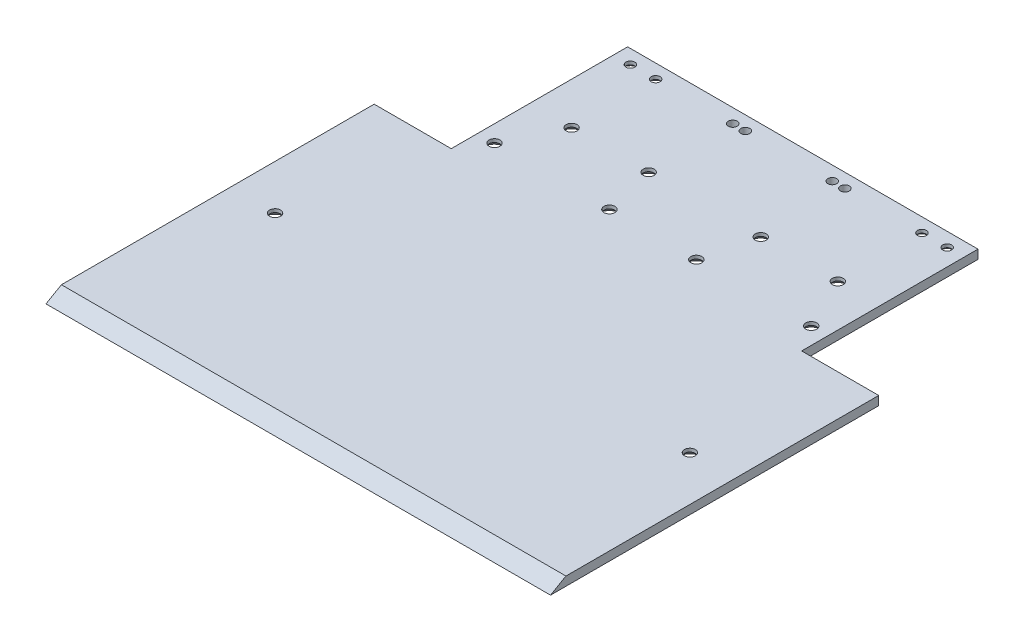
from build123d import *

# Parameters (mm, degrees)
SALIENTE_EXTRUIR1_DEPTH                      = 3.17
CORTAR_EXTRUIR1_REACH                        = 203.271
CORTAR_EXTRUIR2_REACH                        = 129.319
CROQUIS3_R                                   = 1.585
CORTAR_EXTRUIR3_REACH                        = 129.319
CROQUIS4_R                                   = 1.585
CORTAR_EXTRUIR4_REACH                        = 129.319
CROQUIS6_R                                   = 1.585
CORTAR_EXTRUIR5_REACH                        = 129.319
CROQUIS7_R                                   = 1.585
CROQUIS15_R                                  = 4
CORTAR_EXTRUIR6_DEPTH                        = 2
CORTAR_EXTRUIR6_DRAFT                        = -50.5
CORTAR_EXTRUIR6_PROFILE_2_DEPTH              = 2
CORTAR_EXTRUIR6_PROFILE_2_DRAFT              = -50.5
CORTAR_EXTRUIR6_PROFILE_3_DEPTH              = 2
CORTAR_EXTRUIR6_PROFILE_3_DRAFT              = -50.5
CORTAR_EXTRUIR6_PROFILE_4_DEPTH              = 2
CORTAR_EXTRUIR6_PROFILE_4_DRAFT              = -50.5
CORTAR_EXTRUIR6_PROFILE_5_DEPTH              = 2
CORTAR_EXTRUIR6_PROFILE_5_DRAFT              = -50.5
CORTAR_EXTRUIR6_PROFILE_6_DEPTH              = 2
CORTAR_EXTRUIR6_PROFILE_6_DRAFT              = -50.5
CORTAR_EXTRUIR6_PROFILE_7_DEPTH              = 2
CORTAR_EXTRUIR6_PROFILE_7_DRAFT              = -50.5
SIMETR_A3_COPY_1_SKETCH_R                    = 4
SIMETR_A3_COPY_1_DEPTH                       = 2
SIMETR_A3_COPY_1_DRAFT                       = -50.5
SIMETR_A3_COPY_2_SKETCH_R                    = 4
SIMETR_A3_COPY_2_DEPTH                       = 2
SIMETR_A3_COPY_2_DRAFT                       = -50.5
SIMETR_A3_COPY_3_SKETCH_R                    = 4
SIMETR_A3_COPY_3_DEPTH                       = 2
SIMETR_A3_COPY_3_DRAFT                       = -50.5
SIMETR_A3_COPY_4_SKETCH_R                    = 4
SIMETR_A3_COPY_4_DEPTH                       = 2
SIMETR_A3_COPY_4_DRAFT                       = -50.5
SIMETR_A3_COPY_5_SKETCH_R                    = 4
SIMETR_A3_COPY_5_DEPTH                       = 2
SIMETR_A3_COPY_5_DRAFT                       = -50.5
SIMETR_A3_COPY_6_SKETCH_R                    = 4
SIMETR_A3_COPY_6_DEPTH                       = 2
SIMETR_A3_COPY_6_DRAFT                       = -50.5
SIMETR_A3_COPY_7_SKETCH_R                    = 4
SIMETR_A3_COPY_7_DEPTH                       = 2
SIMETR_A3_COPY_7_DRAFT                       = -50.5
SIMETR_A3_COPY_8_SKETCH_R                    = 4
SIMETR_A3_COPY_8_DEPTH                       = 2
SIMETR_A3_COPY_8_DRAFT                       = -50.5
SIMETR_A3_COPY_9_SKETCH_R                    = 4
SIMETR_A3_COPY_9_DEPTH                       = 2
SIMETR_A3_COPY_9_DRAFT                       = -50.5
SIMETR_A3_COPY_10_SKETCH_R                   = 4
SIMETR_A3_COPY_10_DEPTH                      = 2
SIMETR_A3_COPY_10_DRAFT                      = -50.5
SIMETR_A3_COPY_11_SKETCH_R                   = 4
SIMETR_A3_COPY_11_DEPTH                      = 2
SIMETR_A3_COPY_11_DRAFT                      = -50.5
SIMETR_A3_COPY_12_SKETCH_R                   = 4
SIMETR_A3_COPY_12_DEPTH                      = 2
SIMETR_A3_COPY_12_DRAFT                      = -50.5
SIMETR_A3_COPY_13_SKETCH_R                   = 4
SIMETR_A3_COPY_13_DEPTH                      = 2
SIMETR_A3_COPY_13_DRAFT                      = -50.5
AVELLANADO_PARA_TORNILLO_CON_CABEZA_2_COUNT  = 2
AVELLANADO_PARA_TORNILLO_CON_CABEZA_2_PITCH  = 63.24912037
AVELLANADO_PARA_TORNILLO_CON_CABEZA_3_COUNT  = 2
AVELLANADO_PARA_TORNILLO_CON_CABEZA_3_PITCH  = 83.591620659
AVELLANADO_PARA_TORNILLO_CON_CABEZA_4_COUNT  = 2
AVELLANADO_PARA_TORNILLO_CON_CABEZA_4_PITCH  = 95.923454089
AVELLANADO_PARA_TORNILLO_CON_CABEZA_5_COUNT  = 2
AVELLANADO_PARA_TORNILLO_CON_CABEZA_5_PITCH  = 84.359061325
AVELLANADO_PARA_TORNILLO_CON_CABEZA_6_COUNT  = 2
AVELLANADO_PARA_TORNILLO_CON_CABEZA_6_PITCH  = 108.187112114
AVELLANADO_PARA_TORNILLO_CON_CABEZA_7_COUNT  = 2
AVELLANADO_PARA_TORNILLO_CON_CABEZA_7_PITCH  = 122.968731979
AVELLANADO_PARA_TORNILLO_CON_CABEZA_8_COUNT  = 2
AVELLANADO_PARA_TORNILLO_CON_CABEZA_8_PITCH  = 145.077768953
AVELLANADO_PARA_TORNILLO_CON_CABEZA_9_COUNT  = 2
AVELLANADO_PARA_TORNILLO_CON_CABEZA_9_PITCH  = 143.959894511
AVELLANADO_PARA_TORNILLO_CON_CABEZA_10_COUNT = 2
AVELLANADO_PARA_TORNILLO_CON_CABEZA_10_PITCH = 148


with BuildPart() as part:
    # Croquis1 → Saliente-Extruir1 (new body)
    with BuildSketch(Plane(origin=(0, 0, 0), x_dir=(1, 0, 0), z_dir=(0, 1, 0))):
        Polygon((-62.5, 90), (-62.5, 27.08), (-90, 27.08), (-90, -90), (90, -90), (90, 27.08), (62.5, 27.08), (62.5, 90), align=None)
    extrude(amount=SALIENTE_EXTRUIR1_DEPTH)

    # Croquis2 → Cortar-Extruir1 (cut, up to next)
    with BuildSketch(Plane.ZY.offset(90), mode=Mode.PRIVATE) as cortar_extruir1_sk1:
        Polygon((90, 0), (84.50939894, 3.17), (90, 3.17), align=None)
    cortar_extruir1_tool1 = extrude(cortar_extruir1_sk1.sketch, amount=-CORTAR_EXTRUIR1_REACH, mode=Mode.PRIVATE) & part.part
    add(cortar_extruir1_tool1.solids().sort_by_distance((-90, 2.113333, 88.1698))[0], mode=Mode.SUBTRACT)

    # Croquis3 → Cortar-Extruir2 (cut, up to next)
    with BuildSketch(Plane(origin=(0, 3.17, 0), x_dir=(1, 0, 0), z_dir=(0, 1, 0)), mode=Mode.PRIVATE) as cortar_extruir2_sk1:
        with Locations((74, -24.279339937)):
            Circle(CROQUIS3_R)
    cortar_extruir2_tool1 = extrude(cortar_extruir2_sk1.sketch, amount=-CORTAR_EXTRUIR2_REACH, mode=Mode.PRIVATE) & part.part
    cortar_extruir2 = cortar_extruir2_tool1.solids().sort_by_distance((74, 3.17, 24.27934))[0]
    add(cortar_extruir2, mode=Mode.SUBTRACT)

    # Simetría1: Cortar-Extruir2 across plane
    add(cortar_extruir2.mirror(Plane(origin=(0, 0, 0), x_dir=(0, 0, 1), z_dir=(1, 0, 0))), mode=Mode.SUBTRACT)

    # Croquis4 → Cortar-Extruir3 (cut, up to next)
    with BuildSketch(Plane(origin=(0, 3.17, 0), x_dir=(1, 0, 0), z_dir=(0, 1, 0)), mode=Mode.PRIVATE) as cortar_extruir3_sk1:
        with Locations((-56.5, 36.50060106)):
            Circle(CROQUIS4_R)
    cortar_extruir3_tool1 = extrude(cortar_extruir3_sk1.sketch, amount=-CORTAR_EXTRUIR3_REACH, mode=Mode.PRIVATE) & part.part
    # Croquis4 → Cortar-Extruir3 (cut, up to next)
    with BuildSketch(Plane(origin=(0, 3.17, 0), x_dir=(1, 0, 0), z_dir=(0, 1, 0)), mode=Mode.PRIVATE) as cortar_extruir3_sk2:
        with Locations((-15.5, 36.50060106)):
            Circle(CROQUIS4_R)
    cortar_extruir3_tool2 = extrude(cortar_extruir3_sk2.sketch, amount=-CORTAR_EXTRUIR3_REACH, mode=Mode.PRIVATE) & part.part
    # Croquis4 → Cortar-Extruir3 (cut, up to next)
    with BuildSketch(Plane(origin=(0, 3.17, 0), x_dir=(1, 0, 0), z_dir=(0, 1, 0)), mode=Mode.PRIVATE) as cortar_extruir3_sk3:
        with Locations((-15.5, 85.00060106)):
            Circle(CROQUIS4_R)
    cortar_extruir3_tool3 = extrude(cortar_extruir3_sk3.sketch, amount=-CORTAR_EXTRUIR3_REACH, mode=Mode.PRIVATE) & part.part
    # Croquis4 → Cortar-Extruir3 (cut, up to next)
    with BuildSketch(Plane(origin=(0, 3.17, 0), x_dir=(1, 0, 0), z_dir=(0, 1, 0)), mode=Mode.PRIVATE) as cortar_extruir3_sk4:
        with Locations((-56.5, 85.00060106)):
            Circle(CROQUIS4_R)
    cortar_extruir3_tool4 = extrude(cortar_extruir3_sk4.sketch, amount=-CORTAR_EXTRUIR3_REACH, mode=Mode.PRIVATE) & part.part
    add(cortar_extruir3_tool1.solids().sort_by_distance((-56.5, 3.17, -36.500601))[0], mode=Mode.SUBTRACT)
    add(cortar_extruir3_tool2.solids().sort_by_distance((-15.5, 3.17, -36.500601))[0], mode=Mode.SUBTRACT)
    add(cortar_extruir3_tool3.solids().sort_by_distance((-15.5, 3.17, -85.000601))[0], mode=Mode.SUBTRACT)
    add(cortar_extruir3_tool4.solids().sort_by_distance((-56.5, 3.17, -85.000601))[0], mode=Mode.SUBTRACT)

    # Croquis6 → Cortar-Extruir4 (cut, up to next)
    with BuildSketch(Plane(origin=(0, 3.17, 0), x_dir=(1, 0, 0), z_dir=(0, 1, 0)), mode=Mode.PRIVATE) as cortar_extruir4_sk1:
        with Locations((56.5, 85.00060106)):
            Circle(CROQUIS6_R)
    cortar_extruir4_tool1 = extrude(cortar_extruir4_sk1.sketch, amount=-CORTAR_EXTRUIR4_REACH, mode=Mode.PRIVATE) & part.part
    # Croquis6 → Cortar-Extruir4 (cut, up to next)
    with BuildSketch(Plane(origin=(0, 3.17, 0), x_dir=(1, 0, 0), z_dir=(0, 1, 0)), mode=Mode.PRIVATE) as cortar_extruir4_sk2:
        with Locations((15.5, 85.00060106)):
            Circle(CROQUIS6_R)
    cortar_extruir4_tool2 = extrude(cortar_extruir4_sk2.sketch, amount=-CORTAR_EXTRUIR4_REACH, mode=Mode.PRIVATE) & part.part
    # Croquis6 → Cortar-Extruir4 (cut, up to next)
    with BuildSketch(Plane(origin=(0, 3.17, 0), x_dir=(1, 0, 0), z_dir=(0, 1, 0)), mode=Mode.PRIVATE) as cortar_extruir4_sk3:
        with Locations((15.5, 36.50060106)):
            Circle(CROQUIS6_R)
    cortar_extruir4_tool3 = extrude(cortar_extruir4_sk3.sketch, amount=-CORTAR_EXTRUIR4_REACH, mode=Mode.PRIVATE) & part.part
    # Croquis6 → Cortar-Extruir4 (cut, up to next)
    with BuildSketch(Plane(origin=(0, 3.17, 0), x_dir=(1, 0, 0), z_dir=(0, 1, 0)), mode=Mode.PRIVATE) as cortar_extruir4_sk4:
        with Locations((56.5, 36.50060106)):
            Circle(CROQUIS6_R)
    cortar_extruir4_tool4 = extrude(cortar_extruir4_sk4.sketch, amount=-CORTAR_EXTRUIR4_REACH, mode=Mode.PRIVATE) & part.part
    add(cortar_extruir4_tool1.solids().sort_by_distance((56.5, 3.17, -85.000601))[0], mode=Mode.SUBTRACT)
    add(cortar_extruir4_tool2.solids().sort_by_distance((15.5, 3.17, -85.000601))[0], mode=Mode.SUBTRACT)
    add(cortar_extruir4_tool3.solids().sort_by_distance((15.5, 3.17, -36.500601))[0], mode=Mode.SUBTRACT)
    add(cortar_extruir4_tool4.solids().sort_by_distance((56.5, 3.17, -36.500601))[0], mode=Mode.SUBTRACT)

    # Croquis7 → Cortar-Extruir5 (cut, up to next)
    with BuildSketch(Plane(origin=(0, 3.17, 0), x_dir=(1, 0, 0), z_dir=(0, 1, 0)), mode=Mode.PRIVATE) as cortar_extruir5_sk1:
        with Locations((-20, 85.00060106)):
            Circle(CROQUIS7_R)
    cortar_extruir5_tool1 = extrude(cortar_extruir5_sk1.sketch, amount=-CORTAR_EXTRUIR5_REACH, mode=Mode.PRIVATE) & part.part
    # Croquis7 → Cortar-Extruir5 (cut, up to next)
    with BuildSketch(Plane(origin=(0, 3.17, 0), x_dir=(1, 0, 0), z_dir=(0, 1, 0)), mode=Mode.PRIVATE) as cortar_extruir5_sk2:
        with Locations((-47.5, 85.00060106)):
            Circle(CROQUIS7_R)
    cortar_extruir5_tool2 = extrude(cortar_extruir5_sk2.sketch, amount=-CORTAR_EXTRUIR5_REACH, mode=Mode.PRIVATE) & part.part
    # Croquis7 → Cortar-Extruir5 (cut, up to next)
    with BuildSketch(Plane(origin=(0, 3.17, 0), x_dir=(1, 0, 0), z_dir=(0, 1, 0)), mode=Mode.PRIVATE) as cortar_extruir5_sk3:
        with Locations((-47.5, 55.00060106)):
            Circle(CROQUIS7_R)
    cortar_extruir5_tool3 = extrude(cortar_extruir5_sk3.sketch, amount=-CORTAR_EXTRUIR5_REACH, mode=Mode.PRIVATE) & part.part
    # Croquis7 → Cortar-Extruir5 (cut, up to next)
    with BuildSketch(Plane(origin=(0, 3.17, 0), x_dir=(1, 0, 0), z_dir=(0, 1, 0)), mode=Mode.PRIVATE) as cortar_extruir5_sk4:
        with Locations((-20, 55.00060106)):
            Circle(CROQUIS7_R)
    cortar_extruir5_tool4 = extrude(cortar_extruir5_sk4.sketch, amount=-CORTAR_EXTRUIR5_REACH, mode=Mode.PRIVATE) & part.part
    cortar_extruir5_1 = cortar_extruir5_tool1.solids().sort_by_distance((-20, 3.17, -85.000601))[0]
    add(cortar_extruir5_1, mode=Mode.SUBTRACT)
    cortar_extruir5_2 = cortar_extruir5_tool2.solids().sort_by_distance((-47.5, 3.17, -85.000601))[0]
    add(cortar_extruir5_2, mode=Mode.SUBTRACT)
    cortar_extruir5_3 = cortar_extruir5_tool3.solids().sort_by_distance((-47.5, 3.17, -55.000601))[0]
    add(cortar_extruir5_3, mode=Mode.SUBTRACT)
    cortar_extruir5_4 = cortar_extruir5_tool4.solids().sort_by_distance((-20, 3.17, -55.000601))[0]
    add(cortar_extruir5_4, mode=Mode.SUBTRACT)
    cortar_extruir5 = cortar_extruir5_1 + cortar_extruir5_2 + cortar_extruir5_3 + cortar_extruir5_4  # Cortar-Extruir5 as one shape, for the pattern or mirror that repeats it

    # Simetría2: Cortar-Extruir5 across plane
    add(cortar_extruir5.mirror(Plane(origin=(0, 0, 0), x_dir=(0, 0, 1), z_dir=(1, 0, 0))), mode=Mode.SUBTRACT)


with BuildPart() as cortar_extruir6_tool:
    # Croquis15 → Cortar-Extruir6 (with draft: the straight prism first)
    with BuildSketch(Plane(origin=(0, 0, 0), x_dir=(-1, 0, 0), z_dir=(0, -1, 0))):
        with Locations((20, 55.00060106)):
            Circle(CROQUIS15_R)
    extrude(amount=-CORTAR_EXTRUIR6_DEPTH)
    # Cortar-Extruir6: the draft: its side faces are tilted about the plane it starts from
    cortar_extruir6_sides = [cortar_extruir6_tool.faces().sort_by_distance(p)[0] for p in [
        (-16, 1, -55.00060106),
    ]]
    draft(cortar_extruir6_sides, Plane(origin=(0, 0, 0), x_dir=(-1, 0, 0), z_dir=(0, -1, 0)), CORTAR_EXTRUIR6_DRAFT)


with BuildPart() as part_1:
    add(part.part)

    # Cortar-Extruir6: cut by cortar_extruir6_tool
    add(cortar_extruir6_tool.part, mode=Mode.SUBTRACT)


with BuildPart() as cortar_extruir6_profile_2_tool:
    # Croquis15 → Cortar-Extruir6 profile 2 (with draft: the straight prism first)
    with BuildSketch(Plane(origin=(0, 0, 0), x_dir=(-1, 0, 0), z_dir=(0, -1, 0))):
        with Locations((15.5, 36.50060106)):
            Circle(CROQUIS15_R)
    extrude(amount=-CORTAR_EXTRUIR6_PROFILE_2_DEPTH)
    # Cortar-Extruir6 profile 2: the draft: its side faces are tilted about the plane it starts from
    cortar_extruir6_profile_2_sides = [cortar_extruir6_profile_2_tool.faces().sort_by_distance(p)[0] for p in [
        (-11.5, 1, -36.50060106),
    ]]
    draft(cortar_extruir6_profile_2_sides, Plane(origin=(0, 0, 0), x_dir=(-1, 0, 0), z_dir=(0, -1, 0)), CORTAR_EXTRUIR6_PROFILE_2_DRAFT)


with BuildPart() as part_2:
    add(part_1.part)

    # Cortar-Extruir6 profile 2: cut by cortar_extruir6_profile_2_tool
    add(cortar_extruir6_profile_2_tool.part, mode=Mode.SUBTRACT)


with BuildPart() as cortar_extruir6_profile_3_tool:
    # Croquis15 → Cortar-Extruir6 profile 3 (with draft: the straight prism first)
    with BuildSketch(Plane(origin=(0, 0, 0), x_dir=(-1, 0, 0), z_dir=(0, -1, 0))):
        with Locations((56.5, 36.50060106)):
            Circle(CROQUIS15_R)
    extrude(amount=-CORTAR_EXTRUIR6_PROFILE_3_DEPTH)
    # Cortar-Extruir6 profile 3: the draft: its side faces are tilted about the plane it starts from
    cortar_extruir6_profile_3_sides = [cortar_extruir6_profile_3_tool.faces().sort_by_distance(p)[0] for p in [
        (-52.5, 1, -36.50060106),
    ]]
    draft(cortar_extruir6_profile_3_sides, Plane(origin=(0, 0, 0), x_dir=(-1, 0, 0), z_dir=(0, -1, 0)), CORTAR_EXTRUIR6_PROFILE_3_DRAFT)


with BuildPart() as part_3:
    add(part_2.part)

    # Cortar-Extruir6 profile 3: cut by cortar_extruir6_profile_3_tool
    add(cortar_extruir6_profile_3_tool.part, mode=Mode.SUBTRACT)


with BuildPart() as cortar_extruir6_profile_4_tool:
    # Croquis15 → Cortar-Extruir6 profile 4 (with draft: the straight prism first)
    with BuildSketch(Plane(origin=(0, 0, 0), x_dir=(-1, 0, 0), z_dir=(0, -1, 0))):
        with Locations((47.5, 55.00060106)):
            Circle(CROQUIS15_R)
    extrude(amount=-CORTAR_EXTRUIR6_PROFILE_4_DEPTH)
    # Cortar-Extruir6 profile 4: the draft: its side faces are tilted about the plane it starts from
    cortar_extruir6_profile_4_sides = [cortar_extruir6_profile_4_tool.faces().sort_by_distance(p)[0] for p in [
        (-43.5, 1, -55.00060106),
    ]]
    draft(cortar_extruir6_profile_4_sides, Plane(origin=(0, 0, 0), x_dir=(-1, 0, 0), z_dir=(0, -1, 0)), CORTAR_EXTRUIR6_PROFILE_4_DRAFT)


with BuildPart() as part_4:
    add(part_3.part)

    # Cortar-Extruir6 profile 4: cut by cortar_extruir6_profile_4_tool
    add(cortar_extruir6_profile_4_tool.part, mode=Mode.SUBTRACT)


with BuildPart() as cortar_extruir6_profile_5_tool:
    # Croquis15 → Cortar-Extruir6 profile 5 (with draft: the straight prism first)
    with BuildSketch(Plane(origin=(0, 0, 0), x_dir=(-1, 0, 0), z_dir=(0, -1, 0))):
        with Locations((56.5, 85.00060106)):
            Circle(CROQUIS15_R)
    extrude(amount=-CORTAR_EXTRUIR6_PROFILE_5_DEPTH)
    # Cortar-Extruir6 profile 5: the draft: its side faces are tilted about the plane it starts from
    cortar_extruir6_profile_5_sides = [cortar_extruir6_profile_5_tool.faces().sort_by_distance(p)[0] for p in [
        (-52.5, 1, -85.00060106),
    ]]
    draft(cortar_extruir6_profile_5_sides, Plane(origin=(0, 0, 0), x_dir=(-1, 0, 0), z_dir=(0, -1, 0)), CORTAR_EXTRUIR6_PROFILE_5_DRAFT)


with BuildPart() as part_5:
    add(part_4.part)

    # Cortar-Extruir6 profile 5: cut by cortar_extruir6_profile_5_tool
    add(cortar_extruir6_profile_5_tool.part, mode=Mode.SUBTRACT)


with BuildPart() as cortar_extruir6_profile_6_tool:
    # Croquis15 → Cortar-Extruir6 profile 6 (with draft: the straight prism first)
    with BuildSketch(Plane(origin=(0, 0, 0), x_dir=(-1, 0, 0), z_dir=(0, -1, 0))):
        with Locations((47.5, 85.00060106)):
            Circle(CROQUIS15_R)
    extrude(amount=-CORTAR_EXTRUIR6_PROFILE_6_DEPTH)
    # Cortar-Extruir6 profile 6: the draft: its side faces are tilted about the plane it starts from
    cortar_extruir6_profile_6_sides = [cortar_extruir6_profile_6_tool.faces().sort_by_distance(p)[0] for p in [
        (-43.5, 1, -85.00060106),
    ]]
    draft(cortar_extruir6_profile_6_sides, Plane(origin=(0, 0, 0), x_dir=(-1, 0, 0), z_dir=(0, -1, 0)), CORTAR_EXTRUIR6_PROFILE_6_DRAFT)


with BuildPart() as part_6:
    add(part_5.part)

    # Cortar-Extruir6 profile 6: cut by cortar_extruir6_profile_6_tool
    add(cortar_extruir6_profile_6_tool.part, mode=Mode.SUBTRACT)


with BuildPart() as cortar_extruir6_profile_7_tool:
    # Croquis15 → Cortar-Extruir6 profile 7 (with draft: the straight prism first)
    with BuildSketch(Plane(origin=(0, 0, 0), x_dir=(-1, 0, 0), z_dir=(0, -1, 0))):
        with Locations((74, -24.279339937)):
            Circle(CROQUIS15_R)
    extrude(amount=-CORTAR_EXTRUIR6_PROFILE_7_DEPTH)
    # Cortar-Extruir6 profile 7: the draft: its side faces are tilted about the plane it starts from
    cortar_extruir6_profile_7_sides = [cortar_extruir6_profile_7_tool.faces().sort_by_distance(p)[0] for p in [
        (-70, 1, 24.279339937),
    ]]
    draft(cortar_extruir6_profile_7_sides, Plane(origin=(0, 0, 0), x_dir=(-1, 0, 0), z_dir=(0, -1, 0)), CORTAR_EXTRUIR6_PROFILE_7_DRAFT)


with BuildPart() as part_7:
    add(part_6.part)

    # Cortar-Extruir6 profile 7: cut by cortar_extruir6_profile_7_tool
    add(cortar_extruir6_profile_7_tool.part, mode=Mode.SUBTRACT)


with BuildPart() as simetr_a3_copy_1_tool:
    # Simetría3 copy 1 sketch → Simetría3 copy 1 (with draft: the straight prism first)
    with BuildSketch(Plane.XZ):
        with Locations((20, -55.00060106)):
            Circle(SIMETR_A3_COPY_1_SKETCH_R)
    extrude(amount=-SIMETR_A3_COPY_1_DEPTH)
    # Simetría3 copy 1: the draft: its side faces are tilted about the plane it starts from
    simetr_a3_copy_1_sides = [simetr_a3_copy_1_tool.faces().sort_by_distance(p)[0] for p in [
        (16, 1, -55.00060106),
    ]]
    draft(simetr_a3_copy_1_sides, Plane.XZ, SIMETR_A3_COPY_1_DRAFT)


with BuildPart() as part_8:
    add(part_7.part)

    # Simetría3 copy 1: cut by simetr_a3_copy_1_tool
    add(simetr_a3_copy_1_tool.part, mode=Mode.SUBTRACT)


with BuildPart() as simetr_a3_copy_2_tool:
    # Simetría3 copy 2 sketch → Simetría3 copy 2 (with draft: the straight prism first)
    with BuildSketch(Plane.XZ):
        with Locations((15.5, -36.50060106)):
            Circle(SIMETR_A3_COPY_2_SKETCH_R)
    extrude(amount=-SIMETR_A3_COPY_2_DEPTH)
    # Simetría3 copy 2: the draft: its side faces are tilted about the plane it starts from
    simetr_a3_copy_2_sides = [simetr_a3_copy_2_tool.faces().sort_by_distance(p)[0] for p in [
        (11.5, 1, -36.50060106),
    ]]
    draft(simetr_a3_copy_2_sides, Plane.XZ, SIMETR_A3_COPY_2_DRAFT)


with BuildPart() as part_9:
    add(part_8.part)

    # Simetría3 copy 2: cut by simetr_a3_copy_2_tool
    add(simetr_a3_copy_2_tool.part, mode=Mode.SUBTRACT)


with BuildPart() as simetr_a3_copy_3_tool:
    # Simetría3 copy 3 sketch → Simetría3 copy 3 (with draft: the straight prism first)
    with BuildSketch(Plane.XZ):
        with Locations((56.5, -36.50060106)):
            Circle(SIMETR_A3_COPY_3_SKETCH_R)
    extrude(amount=-SIMETR_A3_COPY_3_DEPTH)
    # Simetría3 copy 3: the draft: its side faces are tilted about the plane it starts from
    simetr_a3_copy_3_sides = [simetr_a3_copy_3_tool.faces().sort_by_distance(p)[0] for p in [
        (52.5, 1, -36.50060106),
    ]]
    draft(simetr_a3_copy_3_sides, Plane.XZ, SIMETR_A3_COPY_3_DRAFT)


with BuildPart() as part_10:
    add(part_9.part)

    # Simetría3 copy 3: cut by simetr_a3_copy_3_tool
    add(simetr_a3_copy_3_tool.part, mode=Mode.SUBTRACT)


with BuildPart() as simetr_a3_copy_4_tool:
    # Simetría3 copy 4 sketch → Simetría3 copy 4 (with draft: the straight prism first)
    with BuildSketch(Plane.XZ):
        with Locations((47.5, -55.00060106)):
            Circle(SIMETR_A3_COPY_4_SKETCH_R)
    extrude(amount=-SIMETR_A3_COPY_4_DEPTH)
    # Simetría3 copy 4: the draft: its side faces are tilted about the plane it starts from
    simetr_a3_copy_4_sides = [simetr_a3_copy_4_tool.faces().sort_by_distance(p)[0] for p in [
        (43.5, 1, -55.00060106),
    ]]
    draft(simetr_a3_copy_4_sides, Plane.XZ, SIMETR_A3_COPY_4_DRAFT)


with BuildPart() as part_11:
    add(part_10.part)

    # Simetría3 copy 4: cut by simetr_a3_copy_4_tool
    add(simetr_a3_copy_4_tool.part, mode=Mode.SUBTRACT)


with BuildPart() as simetr_a3_copy_5_tool:
    # Simetría3 copy 5 sketch → Simetría3 copy 5 (with draft: the straight prism first)
    with BuildSketch(Plane.XZ):
        with Locations((56.5, -85.00060106)):
            Circle(SIMETR_A3_COPY_5_SKETCH_R)
    extrude(amount=-SIMETR_A3_COPY_5_DEPTH)
    # Simetría3 copy 5: the draft: its side faces are tilted about the plane it starts from
    simetr_a3_copy_5_sides = [simetr_a3_copy_5_tool.faces().sort_by_distance(p)[0] for p in [
        (52.5, 1, -85.00060106),
    ]]
    draft(simetr_a3_copy_5_sides, Plane.XZ, SIMETR_A3_COPY_5_DRAFT)


with BuildPart() as part_12:
    add(part_11.part)

    # Simetría3 copy 5: cut by simetr_a3_copy_5_tool
    add(simetr_a3_copy_5_tool.part, mode=Mode.SUBTRACT)


with BuildPart() as simetr_a3_copy_6_tool:
    # Simetría3 copy 6 sketch → Simetría3 copy 6 (with draft: the straight prism first)
    with BuildSketch(Plane.XZ):
        with Locations((47.5, -85.00060106)):
            Circle(SIMETR_A3_COPY_6_SKETCH_R)
    extrude(amount=-SIMETR_A3_COPY_6_DEPTH)
    # Simetría3 copy 6: the draft: its side faces are tilted about the plane it starts from
    simetr_a3_copy_6_sides = [simetr_a3_copy_6_tool.faces().sort_by_distance(p)[0] for p in [
        (43.5, 1, -85.00060106),
    ]]
    draft(simetr_a3_copy_6_sides, Plane.XZ, SIMETR_A3_COPY_6_DRAFT)


with BuildPart() as part_13:
    add(part_12.part)

    # Simetría3 copy 6: cut by simetr_a3_copy_6_tool
    add(simetr_a3_copy_6_tool.part, mode=Mode.SUBTRACT)


with BuildPart() as simetr_a3_copy_7_tool:
    # Simetría3 copy 7 sketch → Simetría3 copy 7 (with draft: the straight prism first)
    with BuildSketch(Plane.XZ):
        with Locations((74, 24.279339937)):
            Circle(SIMETR_A3_COPY_7_SKETCH_R)
    extrude(amount=-SIMETR_A3_COPY_7_DEPTH)
    # Simetría3 copy 7: the draft: its side faces are tilted about the plane it starts from
    simetr_a3_copy_7_sides = [simetr_a3_copy_7_tool.faces().sort_by_distance(p)[0] for p in [
        (70, 1, 24.279339937),
    ]]
    draft(simetr_a3_copy_7_sides, Plane.XZ, SIMETR_A3_COPY_7_DRAFT)


with BuildPart() as part_14:
    add(part_13.part)

    # Simetría3 copy 7: cut by simetr_a3_copy_7_tool
    add(simetr_a3_copy_7_tool.part, mode=Mode.SUBTRACT)


with BuildPart() as simetr_a3_copy_8_tool:
    # Simetría3 copy 8 sketch → Simetría3 copy 8 (with draft: the straight prism first)
    with BuildSketch(Plane.XZ):
        with Locations((15.5, -36.50060106)):
            Circle(SIMETR_A3_COPY_8_SKETCH_R)
    extrude(amount=-SIMETR_A3_COPY_8_DEPTH)
    # Simetría3 copy 8: the draft: its side faces are tilted about the plane it starts from
    simetr_a3_copy_8_sides = [simetr_a3_copy_8_tool.faces().sort_by_distance(p)[0] for p in [
        (11.5, 1, -36.50060106),
    ]]
    draft(simetr_a3_copy_8_sides, Plane.XZ, SIMETR_A3_COPY_8_DRAFT)


with BuildPart() as part_15:
    add(part_14.part)

    # Simetría3 copy 8: cut by simetr_a3_copy_8_tool
    add(simetr_a3_copy_8_tool.part, mode=Mode.SUBTRACT)


with BuildPart() as simetr_a3_copy_9_tool:
    # Simetría3 copy 9 sketch → Simetría3 copy 9 (with draft: the straight prism first)
    with BuildSketch(Plane.XZ):
        with Locations((56.5, -36.50060106)):
            Circle(SIMETR_A3_COPY_9_SKETCH_R)
    extrude(amount=-SIMETR_A3_COPY_9_DEPTH)
    # Simetría3 copy 9: the draft: its side faces are tilted about the plane it starts from
    simetr_a3_copy_9_sides = [simetr_a3_copy_9_tool.faces().sort_by_distance(p)[0] for p in [
        (52.5, 1, -36.50060106),
    ]]
    draft(simetr_a3_copy_9_sides, Plane.XZ, SIMETR_A3_COPY_9_DRAFT)


with BuildPart() as part_16:
    add(part_15.part)

    # Simetría3 copy 9: cut by simetr_a3_copy_9_tool
    add(simetr_a3_copy_9_tool.part, mode=Mode.SUBTRACT)


with BuildPart() as simetr_a3_copy_10_tool:
    # Simetría3 copy 10 sketch → Simetría3 copy 10 (with draft: the straight prism first)
    with BuildSketch(Plane.XZ):
        with Locations((47.5, -55.00060106)):
            Circle(SIMETR_A3_COPY_10_SKETCH_R)
    extrude(amount=-SIMETR_A3_COPY_10_DEPTH)
    # Simetría3 copy 10: the draft: its side faces are tilted about the plane it starts from
    simetr_a3_copy_10_sides = [simetr_a3_copy_10_tool.faces().sort_by_distance(p)[0] for p in [
        (43.5, 1, -55.00060106),
    ]]
    draft(simetr_a3_copy_10_sides, Plane.XZ, SIMETR_A3_COPY_10_DRAFT)


with BuildPart() as part_17:
    add(part_16.part)

    # Simetría3 copy 10: cut by simetr_a3_copy_10_tool
    add(simetr_a3_copy_10_tool.part, mode=Mode.SUBTRACT)


with BuildPart() as simetr_a3_copy_11_tool:
    # Simetría3 copy 11 sketch → Simetría3 copy 11 (with draft: the straight prism first)
    with BuildSketch(Plane.XZ):
        with Locations((56.5, -85.00060106)):
            Circle(SIMETR_A3_COPY_11_SKETCH_R)
    extrude(amount=-SIMETR_A3_COPY_11_DEPTH)
    # Simetría3 copy 11: the draft: its side faces are tilted about the plane it starts from
    simetr_a3_copy_11_sides = [simetr_a3_copy_11_tool.faces().sort_by_distance(p)[0] for p in [
        (52.5, 1, -85.00060106),
    ]]
    draft(simetr_a3_copy_11_sides, Plane.XZ, SIMETR_A3_COPY_11_DRAFT)


with BuildPart() as part_18:
    add(part_17.part)

    # Simetría3 copy 11: cut by simetr_a3_copy_11_tool
    add(simetr_a3_copy_11_tool.part, mode=Mode.SUBTRACT)


with BuildPart() as simetr_a3_copy_12_tool:
    # Simetría3 copy 12 sketch → Simetría3 copy 12 (with draft: the straight prism first)
    with BuildSketch(Plane.XZ):
        with Locations((47.5, -85.00060106)):
            Circle(SIMETR_A3_COPY_12_SKETCH_R)
    extrude(amount=-SIMETR_A3_COPY_12_DEPTH)
    # Simetría3 copy 12: the draft: its side faces are tilted about the plane it starts from
    simetr_a3_copy_12_sides = [simetr_a3_copy_12_tool.faces().sort_by_distance(p)[0] for p in [
        (43.5, 1, -85.00060106),
    ]]
    draft(simetr_a3_copy_12_sides, Plane.XZ, SIMETR_A3_COPY_12_DRAFT)


with BuildPart() as part_19:
    add(part_18.part)

    # Simetría3 copy 12: cut by simetr_a3_copy_12_tool
    add(simetr_a3_copy_12_tool.part, mode=Mode.SUBTRACT)


with BuildPart() as simetr_a3_copy_13_tool:
    # Simetría3 copy 13 sketch → Simetría3 copy 13 (with draft: the straight prism first)
    with BuildSketch(Plane.XZ):
        with Locations((74, 24.279339937)):
            Circle(SIMETR_A3_COPY_13_SKETCH_R)
    extrude(amount=-SIMETR_A3_COPY_13_DEPTH)
    # Simetría3 copy 13: the draft: its side faces are tilted about the plane it starts from
    simetr_a3_copy_13_sides = [simetr_a3_copy_13_tool.faces().sort_by_distance(p)[0] for p in [
        (70, 1, 24.279339937),
    ]]
    draft(simetr_a3_copy_13_sides, Plane.XZ, SIMETR_A3_COPY_13_DRAFT)


with BuildPart() as part_20:
    add(part_19.part)

    # Simetría3 copy 13: cut by simetr_a3_copy_13_tool
    add(simetr_a3_copy_13_tool.part, mode=Mode.SUBTRACT)

    # Croquis14 → Avellanado para tornillo con cabeza avellanada en cruz de M3.51 (revolve, cut)
    with BuildSketch(Plane(origin=(74, 0, 24.279339937), x_dir=(0, 0, -1), z_dir=(1, 0, 0))):
        Polygon((0, 0), (0, 3.17), (1.95, 3.17), (1.95, 1.979661988), (4, 0), align=None)
    avellanado_para_tornillo_con_cabeza_avel = revolve(axis=Axis((74, -6.35, 24.279339937), (0, 1, 0)), mode=Mode.SUBTRACT)

    # Avellanado para tornillo con cabeza  2: Avellanado para tornillo con cabeza avellanada en cruz de M3.51 ×2
    with Locations(*[Vector(-0.276683689791391, 0, -0.9609610480156942) * (i * AVELLANADO_PARA_TORNILLO_CON_CABEZA_2_PITCH) for i in range(1, AVELLANADO_PARA_TORNILLO_CON_CABEZA_2_COUNT)]):
        add(avellanado_para_tornillo_con_cabeza_avel, mode=Mode.SUBTRACT)

    # Avellanado para tornillo con cabeza  3: Avellanado para tornillo con cabeza avellanada en cruz de M3.51 ×2
    with Locations(*[Vector(-0.3170174210166119, 0, -0.9484197144576743) * (i * AVELLANADO_PARA_TORNILLO_CON_CABEZA_3_PITCH) for i in range(1, AVELLANADO_PARA_TORNILLO_CON_CABEZA_3_COUNT)]):
        add(avellanado_para_tornillo_con_cabeza_avel, mode=Mode.SUBTRACT)

    # Avellanado para tornillo con cabeza  4: Avellanado para tornillo con cabeza avellanada en cruz de M3.51 ×2
    with Locations(*[Vector(-0.5629488691021034, 0, -0.8264917245663521) * (i * AVELLANADO_PARA_TORNILLO_CON_CABEZA_4_PITCH) for i in range(1, AVELLANADO_PARA_TORNILLO_CON_CABEZA_4_COUNT)]):
        add(avellanado_para_tornillo_con_cabeza_avel, mode=Mode.SUBTRACT)

    # Avellanado para tornillo con cabeza  5: Avellanado para tornillo con cabeza avellanada en cruz de M3.51 ×2
    with Locations(*[Vector(-0.6934643307008228, 0, -0.7204909590311733) * (i * AVELLANADO_PARA_TORNILLO_CON_CABEZA_5_PITCH) for i in range(1, AVELLANADO_PARA_TORNILLO_CON_CABEZA_5_COUNT)]):
        add(avellanado_para_tornillo_con_cabeza_avel, mode=Mode.SUBTRACT)

    # Avellanado para tornillo con cabeza  6: Avellanado para tornillo con cabeza avellanada en cruz de M3.51 ×2
    with Locations(*[Vector(-0.8272704414709033, 0, -0.5618038952059133) * (i * AVELLANADO_PARA_TORNILLO_CON_CABEZA_6_PITCH) for i in range(1, AVELLANADO_PARA_TORNILLO_CON_CABEZA_6_COUNT)]):
        add(avellanado_para_tornillo_con_cabeza_avel, mode=Mode.SUBTRACT)

    # Avellanado para tornillo con cabeza  7: Avellanado para tornillo con cabeza avellanada en cruz de M3.51 ×2
    with Locations(*[Vector(-0.764421967173756, 0, -0.6447162601503124) * (i * AVELLANADO_PARA_TORNILLO_CON_CABEZA_7_PITCH) for i in range(1, AVELLANADO_PARA_TORNILLO_CON_CABEZA_7_COUNT)]):
        add(avellanado_para_tornillo_con_cabeza_avel, mode=Mode.SUBTRACT)

    # Avellanado para tornillo con cabeza  8: Avellanado para tornillo con cabeza avellanada en cruz de M3.51 ×2
    with Locations(*[Vector(-0.8374818614641102, 0, -0.5464651239728012) * (i * AVELLANADO_PARA_TORNILLO_CON_CABEZA_8_PITCH) for i in range(1, AVELLANADO_PARA_TORNILLO_CON_CABEZA_8_COUNT)]):
        add(avellanado_para_tornillo_con_cabeza_avel, mode=Mode.SUBTRACT)

    # Avellanado para tornillo con cabeza  9: Avellanado para tornillo con cabeza avellanada en cruz de M3.51 ×2
    with Locations(*[Vector(-0.9065024703126479, 0, -0.42220051079678633) * (i * AVELLANADO_PARA_TORNILLO_CON_CABEZA_9_PITCH) for i in range(1, AVELLANADO_PARA_TORNILLO_CON_CABEZA_9_COUNT)]):
        add(avellanado_para_tornillo_con_cabeza_avel, mode=Mode.SUBTRACT)

    # Avellanado para tornillo con cabeza  10: Avellanado para tornillo con cabeza avellanada en cruz de M3.51 ×2
    with Locations(*[(-i * AVELLANADO_PARA_TORNILLO_CON_CABEZA_10_PITCH, 0, 0) for i in range(1, AVELLANADO_PARA_TORNILLO_CON_CABEZA_10_COUNT)]):
        add(avellanado_para_tornillo_con_cabeza_avel, mode=Mode.SUBTRACT)


solid = part_20.part
